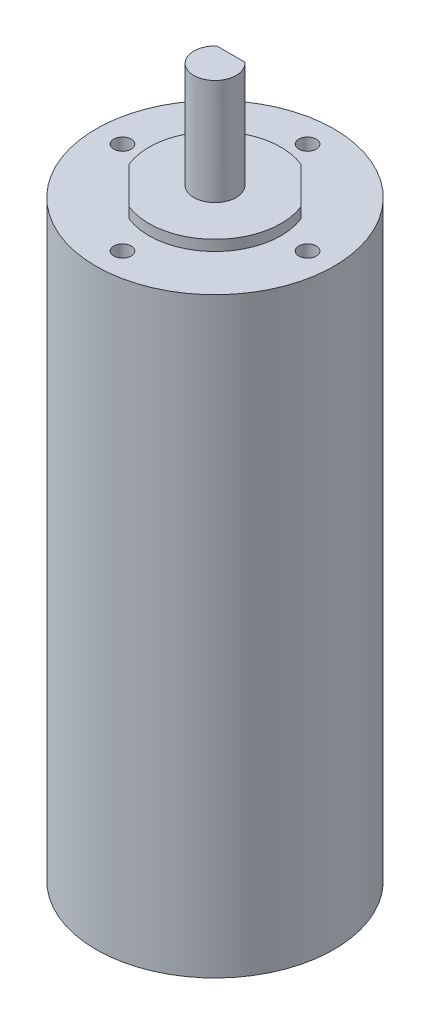
from build123d import *

# Parameters (mm, degrees)
SKETCH1_R           = 22.5
BOSS_EXTRUDE1_DEPTH = 111.9
BOSS_EXTRUDE2_DEPTH = 2
SKETCH3_R           = 4
BOSS_EXTRUDE3_DEPTH = 8
BOSS_EXTRUDE4_DEPTH = 12
SKETCH5_R           = 1.65
CUT_EXTRUDE1_DEPTH  = 6


with BuildPart() as part:
    # Sketch1 → Boss-Extrude1 (new body)
    with BuildSketch(Plane(origin=(0, 0, 0), x_dir=(1, 0, 0), z_dir=(0, 1, 0))):
        Circle(SKETCH1_R)
    extrude(amount=BOSS_EXTRUDE1_DEPTH)

    # Sketch2 → Boss-Extrude2 (add)
    with BuildSketch(Plane(origin=(0, 111.9, 0), x_dir=(1, 0, 0), z_dir=(0, 1, 0))):
        with BuildLine():
            Line((-11.595829599, -4.667626369), (-4.667626369, -11.595829599))
            ThreePointArc((-4.667626369, -11.595829599), (8.838834765, -8.838834765), (11.595829599, 4.667626369))
            Line((11.595829599, 4.667626369), (4.667626369, 11.595829599))
            ThreePointArc((4.667626369, 11.595829599), (-8.838834765, 8.838834765), (-11.595829599, -4.667626369))
        make_face()
    extrude(amount=BOSS_EXTRUDE2_DEPTH)

    # Sketch3 → Boss-Extrude3 (add)
    with BuildSketch(Plane(origin=(0, 113.9, 0), x_dir=(1, 0, 0), z_dir=(0, 1, 0))):
        Circle(SKETCH3_R)
    extrude(amount=BOSS_EXTRUDE3_DEPTH)

    # Sketch4 → Boss-Extrude4 (add)
    with BuildSketch(Plane(origin=(0, 121.9, 0), x_dir=(1, 0, 0), z_dir=(0, 1, 0))):
        with BuildLine():
            Line((-2.645751311, 3), (2.645751311, 3))
            ThreePointArc((2.645751311, 3), (0, -4), (-2.645751311, 3))
        make_face()
    extrude(amount=BOSS_EXTRUDE4_DEPTH)

    # Sketch5 → Cut-Extrude1 (cut)
    with BuildSketch(Plane(origin=(0, 111.9, 0), x_dir=(1, 0, 0), z_dir=(0, 1, 0))):
        with Locations((-17.5, 0)):
            Circle(SKETCH5_R)
        with Locations((0, 17.5)):
            Circle(SKETCH5_R)
        with Locations((17.5, 0)):
            Circle(SKETCH5_R)
        with Locations((0, -17.5)):
            Circle(SKETCH5_R)
    extrude(amount=-CUT_EXTRUDE1_DEPTH, mode=Mode.SUBTRACT)


solid = part.part
